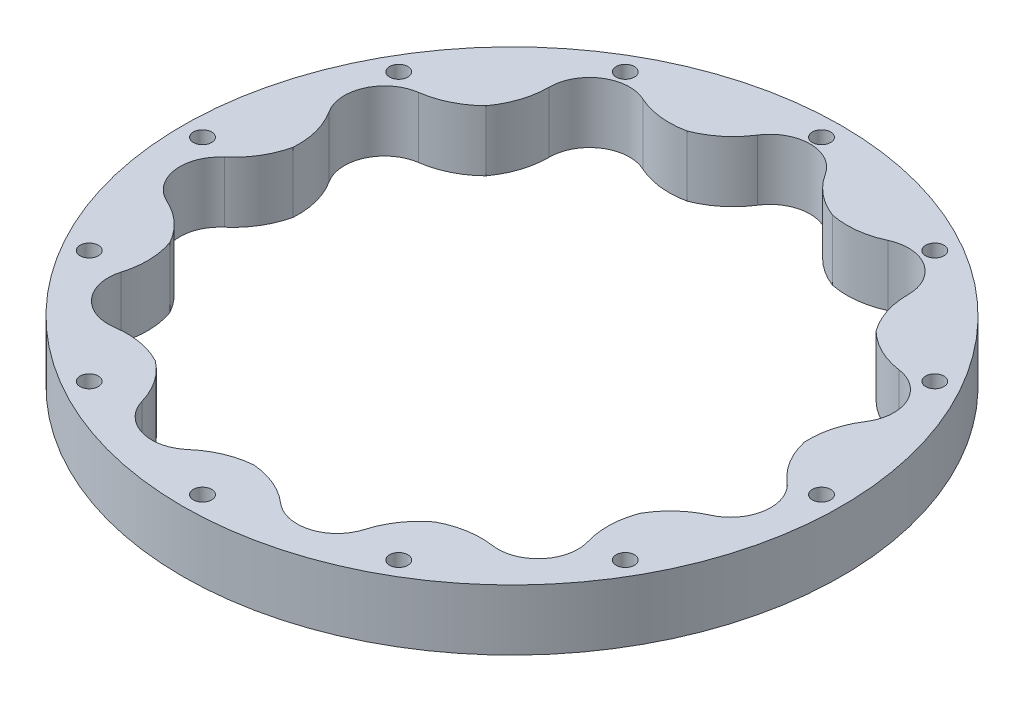
from build123d import *

# Parameters (mm, degrees)
SKETCH1_R           = 57.5
SKETCH1_R_2         = 1.6
BOSS_EXTRUDE1_DEPTH = 10.6
FILLET1_R           = 14


with BuildPart() as part:
    # Sketch1 → Boss-Extrude1 (new body)
    with BuildSketch(Plane(origin=(0, 0, 0), x_dir=(1, 0, 0), z_dir=(0, 1, 0))):
        with Locations(Location((0, 0, 0), (0, 0, 270))):
            Circle(SKETCH1_R)
        with Locations(Location((-27, -46.765371804, 0), (0, 0, 270))):
            Circle(SKETCH1_R_2, mode=Mode.SUBTRACT)
        with Locations(Location((-46.765371804, -27, 0), (0, 0, 270))):
            Circle(SKETCH1_R_2, mode=Mode.SUBTRACT)
        with Locations(Location((-54, 0, 0), (0, 0, 270))):
            Circle(SKETCH1_R_2, mode=Mode.SUBTRACT)
        with Locations(Location((0, -54, 0), (0, 0, 270))):
            Circle(SKETCH1_R_2, mode=Mode.SUBTRACT)
        with Locations(Location((27, -46.765371804, 0), (0, 0, 270))):
            Circle(SKETCH1_R_2, mode=Mode.SUBTRACT)
        with Locations(Location((46.765371804, -27, 0), (0, 0, 270))):
            Circle(SKETCH1_R_2, mode=Mode.SUBTRACT)
        with Locations(Location((-46.765371804, 27, 0), (0, 0, 270))):
            Circle(SKETCH1_R_2, mode=Mode.SUBTRACT)
        with Locations(Location((-27, 46.765371804, 0), (0, 0, 270))):
            Circle(SKETCH1_R_2, mode=Mode.SUBTRACT)
        with BuildLine():
            ThreePointArc((43.337291938, 12.119369929), (44.541964885, 6.404167722), (44.996248187, 0.581075772))
            ThreePointArc((44.996248187, 0.581075772), (49.649801174, -1.617727663), (51.541964885, -6.404167722))
            ThreePointArc((51.541964885, -6.404167722), (48.916629323, -11.868809619), (43.009876012, -13.234446171))
            ThreePointArc((43.009876012, -13.234446171), (40.933439791, -18.693675585), (38.167406032, -23.837976356))
            ThreePointArc((38.167406032, -23.837976356), (40.258159872, -26.3152212), (41.008730846, -29.468733028))
            ThreePointArc((41.008730846, -29.468733028), (36.666623102, -35.944503928), (29.027128345, -34.386419122))
            ThreePointArc((29.027128345, -34.386419122), (24.328836786, -37.856408977), (19.22068214, -40.688639423))
            ThreePointArc((19.22068214, -40.688639423), (19.562695248, -41.91207899), (19.677965058, -43.177183813))
            ThreePointArc((19.677965058, -43.177183813), (13.403758509, -50.139455271), (5.828472525, -44.620946965))
            ThreePointArc((5.828472525, -44.620946965), (0, -45), (-5.828472525, -44.620946965))
            ThreePointArc((-5.828472525, -44.620946965), (-14.650092956, -49.893634628), (-19.22068214, -40.688639423))
            ThreePointArc((-19.22068214, -40.688639423), (-24.328836785, -37.856408977), (-29.027128345, -34.386419122))
            ThreePointArc((-29.027128345, -34.386419122), (-39.298977866, -34.052758165), (-38.167406032, -23.837976356))
            ThreePointArc((-38.167406032, -23.837976356), (-40.933439791, -18.693675585), (-43.009876012, -13.234446171))
            ThreePointArc((-43.009876012, -13.234446171), (-51.470714978, -7.40037159), (-44.996248187, 0.581075772))
            ThreePointArc((-44.996248187, 0.581075772), (-44.541964885, 6.404167722), (-43.337291938, 12.119369929))
            ThreePointArc((-43.337291938, 12.119369929), (-47.300863758, 21.601580676), (-37.539099471, 24.815640449))
            ThreePointArc((-37.539099471, 24.815640449), (-34.008730846, 29.468733028), (-29.905423881, 33.625371708))
            ThreePointArc((-29.905423881, 33.625371708), (-28.113322508, 43.745183707), (-18.163551911, 41.171414622))
            ThreePointArc((-18.163551911, 41.171414622), (-12.677965058, 43.177183813), (-6.978795043, 44.455555556))
            ThreePointArc((-6.978795043, 44.455555556), (-0.272428616, 51.994696752), (7, 45))
            ThreePointArc((7, 45), (6.994696752, 44.727571384), (6.978795043, 44.455555556))
            ThreePointArc((6.978795043, 44.455555556), (12.677965058, 43.177183813), (18.163551911, 41.171414622))
            ThreePointArc((18.163551911, 41.171414622), (26.038077243, 44.644523374), (31.328836786, 37.856408977))
            ThreePointArc((31.328836786, 37.856408977), (30.963447161, 35.624381834), (29.905423881, 33.625371708))
            ThreePointArc((29.905423881, 33.625371708), (34.008730846, 29.468733028), (37.539099471, 24.815640449))
            ThreePointArc((37.539099471, 24.815640449), (44.485876825, 24.725274968), (47.933439791, 18.693675585))
            ThreePointArc((47.933439791, 18.693675585), (46.670467115, 14.68287548), (43.337291938, 12.119369929))
        make_face(mode=Mode.SUBTRACT)
        with Locations(Location((54, 0, 0), (0, 0, 270))):
            Circle(SKETCH1_R_2, mode=Mode.SUBTRACT)
        with Locations(Location((46.765371804, 27, 0), (0, 0, 270))):
            Circle(SKETCH1_R_2, mode=Mode.SUBTRACT)
        with Locations(Location((0, 54, 0), (0, 0, 270))):
            Circle(SKETCH1_R_2, mode=Mode.SUBTRACT)
        with Locations(Location((27, 46.765371804, 0), (0, 0, 270))):
            Circle(SKETCH1_R_2, mode=Mode.SUBTRACT)
    extrude(amount=BOSS_EXTRUDE1_DEPTH)

    # Fillet1
    # the kernel refuses this fillet: 14 mm, written as the material it takes off along each edge
    with BuildSketch(Plane(origin=(43.009876012, -16.77410228, 13.234446171), x_dir=(-0.3645348982341331, 0, 0.9311897271605987), z_dir=(0, 1, 0)), Plane(origin=(43.337291938, -16.77410228, -12.119369929), x_dir=(0.19677290431862063, 0, 0.9804490930823564), z_dir=(0, 1, 0)), Plane(origin=(29.027128345, -16.77410228, 34.386419122), x_dir=(-0.8101054462780665, 0, 0.586284202337582), z_dir=(0, 1, 0)), Plane(origin=(5.828472525, -16.77410228, 44.620946965), x_dir=(-0.9984732390602963, 0, 0.05523758575861507), z_dir=(0, 1, 0)), Plane(origin=(-19.22068214, -16.77410228, 40.688639423), x_dir=(-0.8698328333156817, 0, -0.4933465740085904), z_dir=(0, 1, 0)), Plane(origin=(-38.167406032, -16.77410228, 23.837976356), x_dir=(-0.46502664893844664, 0, -0.8852966823483972), z_dir=(0, 1, 0)), Plane(origin=(-44.996248187, -16.77410228, -0.581075772), x_dir=(0.0874222107554752, 0, -0.99617134925003), z_dir=(0, 1, 0)), Plane(origin=(-37.539099471, -16.77410228, -24.815640449), x_dir=(0.6121151362303556, 0, -0.7907686513751624), z_dir=(0, 1, 0)), Plane(origin=(-18.163551911, -16.77410228, -41.171414622), x_dir=(0.9424658309509625, 0, -0.334302493992958), z_dir=(0, 1, 0)), Plane(origin=(6.978795043, -16.77410228, -44.455555556), x_dir=(0.9735902834899675, 0, 0.22830234316345693), z_dir=(0, 1, 0))) as fillet1_piece_1:
        with BuildLine():
            CenterArc((7.753362832, 13.961040239), FILLET1_R, 225.679308165, 40.045235058)
            ThreePointArc((-2.028069047, 3.944873787), (-0.693306264, 2.137324059), (0, 0))
            ThreePointArc((0, 0), (3.354820456, 0.125227803), (6.709640912, 0))
        make_face()
    extrude(amount=44.14820456, mode=Mode.SUBTRACT)
    with BuildSketch(Plane(origin=(44.996248187, -16.77410228, -0.581075772), x_dir=(0.9259201789863998, 0, 0.37771923719317424), z_dir=(0, 1, 0)), Plane(origin=(37.539099471, -16.77410228, -24.815640449), x_dir=(0.9831440588568181, 0, -0.18283259975874497), z_dir=(0, 1, 0)), Plane(origin=(38.167406032, -16.77410228, 23.837976356), x_dir=(0.5747231845271455, 0, 0.8183478851729116), z_dir=(0, 1, 0)), Plane(origin=(19.22068214, -16.77410228, 40.688639423), x_dir=(0.041055639780420296, 0, 0.9991568617800813), z_dir=(0, 1, 0)), Plane(origin=(-5.828472525, -16.77410228, 44.620946965), x_dir=(-0.5056467805113274, 0, 0.8627405944770012), z_dir=(0, 1, 0)), Plane(origin=(-29.027128345, -16.77410228, 34.386419122), x_dir=(-0.8918099207200904, 0, 0.4524102842611189), z_dir=(0, 1, 0)), Plane(origin=(-43.009876012, -16.77410228, 13.234446171), x_dir=(-0.994829712327915, 0, -0.10155709462936494), z_dir=(0, 1, 0)), Plane(origin=(-43.337291938, -16.77410228, -12.119369929), x_dir=(-0.7819980994024467, 0, -0.62328081354311), z_dir=(0, 1, 0)), Plane(origin=(-29.905423881, -16.77410228, -33.625371708), x_dir=(-0.3208876152512941, 0, -0.9471172780486783), z_dir=(0, 1, 0)), Plane(origin=(18.163551911, -16.77410228, -41.171414622), x_dir=(0.7282266466043301, 0, -0.6853363781205636), z_dir=(0, 1, 0)), Plane(origin=(-6.978795043, -16.77410228, -44.455555556), x_dir=(0.24210241945853378, 0, -0.9702506987847646), z_dir=(0, 1, 0))) as fillet1_piece_2:
        with BuildLine():
            CenterArc((8.87132307, 13.278738899), FILLET1_R, 211.483261097, 40.045235058)
            ThreePointArc((-3.067775786, 5.967246676), (-1.422516032, 3.040879878), (0, 0))
            ThreePointArc((0, 0), (2.217830767, 0.36063055), (4.435661535, 0))
        make_face()
    extrude(amount=44.14820456, mode=Mode.SUBTRACT)
    with BuildSketch(Plane(origin=(29.905423881, -16.77410228, -33.625371708), x_dir=(0.3208876152513925, 0, -0.9471172780486449), z_dir=(0, 1, 0))) as fillet1_piece_3:
        with BuildLine():
            CenterArc((8.87132307, -13.278738899), FILLET1_R, 108.471503845, 40.045235058)
            ThreePointArc((-3.067775786, -5.967246676), (-1.422516032, -3.040879878), (0, 0))
            ThreePointArc((0, 0), (2.217830767, -0.36063055), (4.435661535, 0))
        make_face()
    extrude(amount=44.14820456, mode=Mode.SUBTRACT)


solid = part.part
